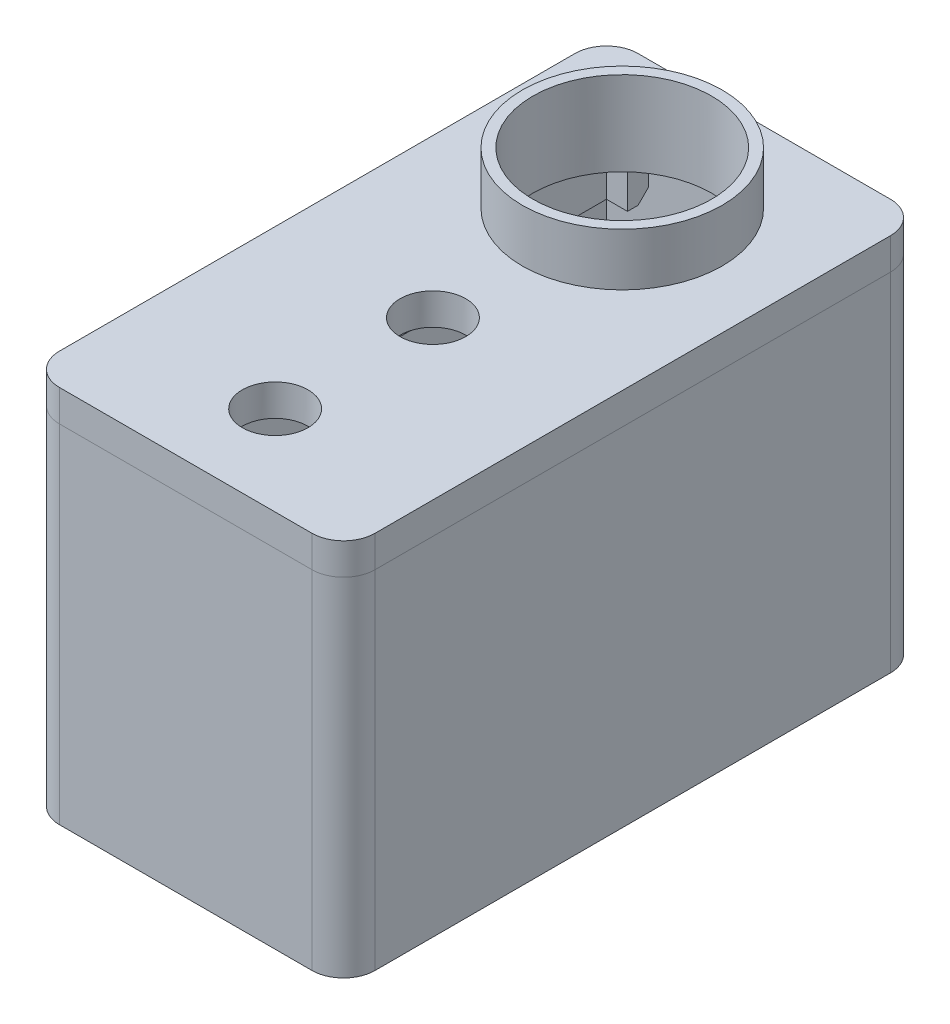
from build123d import *

# Parameters (mm, degrees)
SKETCH1_W                      = 30
SKETCH1_H                      = 55
BOSS_EXTRUDE7_DEPTH            = 3
SKETCH14_W                     = 30
SKETCH14_H                     = 55
SKETCH14_W_2                   = 24
SKETCH14_H_2                   = 49
BOSS_EXTRUDE8_DEPTH            = 33
CUT_EXTRUDE1_DEPTH             = 3
BOSS_EXTRUDE12_DEPTH           = 3
SKETCH31_W                     = 2.2479
SKETCH31_H                     = 3
F_8_CLEARANCE_HOLE3_AT_2_COUNT = 2
F_8_CLEARANCE_HOLE3_AT_2_PITCH = 25
FILLET1_R                      = 3
FILLET2_R                      = 3
FILLET3_R                      = 3
BOSS_EXTRUDE13_DEPTH           = 5
SKETCH36_W                     = 0.75
SKETCH36_H                     = 3.4
CUT_EXTRUDE2_DEPTH             = 6
SKETCH37_R                     = 3.125
SKETCH37_R_2                   = 8.5
CUT_EXTRUDE3_DEPTH             = 3
BOSS_EXTRUDE14_START           = 5
SKETCH38_R                     = 9.5
SKETCH38_R_2                   = 8.5
BOSS_EXTRUDE14_DEPTH           = 5
BOSS_EXTRUDE15_DEPTH           = 5
CHAMFER1_SIZE                  = 1
BOSS_EXTRUDE16_DEPTH           = 3
FILLET4_R                      = 3


with BuildPart() as part:
    # Sketch1 → Boss-Extrude7 (new body)
    with BuildSketch(Plane(origin=(0, 0, 0), x_dir=(1, 0, 0), z_dir=(0, 1, 0))):
        Rectangle(SKETCH1_W, SKETCH1_H)
    extrude(amount=-BOSS_EXTRUDE7_DEPTH)

    # Fillet3
    fillet3_edges = [part.edges().sort_by_distance(p)[0] for p in [
        (15, -1.5, 27.5),
        (-15, -1.5, 27.5),
        (-15, -1.5, -27.5),
        (15, -1.5, -27.5),
    ]]
    fillet(fillet3_edges, radius=FILLET3_R)

    # Sketch35 → Boss-Extrude13 (add, symmetric)
    with BuildSketch(Plane.XY):
        Polygon((10.25, -3), (11.75, -3), (11.75, -8), (12.5, -8), (12.5, -9.5), (11.75, -10.25), (10.25, -10.25), align=None)
        Polygon((-12.5, -9.5), (-11.75, -10.25), (-10.25, -10.25), (-10.25, -3), (-11.75, -3), (-11.75, -8), (-12.5, -8), align=None)
    extrude(amount=BOSS_EXTRUDE13_DEPTH, both=True)

    # Sketch37 → Cut-Extrude3 (cut)
    with BuildSketch(Plane(origin=(0, 0, 0), x_dir=(1, 0, 0), z_dir=(0, 1, 0))):
        with Locations(Location((0, -4, 0), (0, 0, 270))):
            Circle(SKETCH37_R)
        with Locations(Location((0, -19, 0), (0, 0, 270))):
            Circle(SKETCH37_R)
        with Locations(Location((0, 14, 0), (0, 0, 270))):
            Circle(SKETCH37_R_2)
    extrude(amount=-CUT_EXTRUDE3_DEPTH, mode=Mode.SUBTRACT)

    # Sketch38 → Boss-Extrude14 (add)
    with BuildSketch(Plane(origin=(0, 0, 0), x_dir=(1, 0, 0), z_dir=(0, 1, 0)).offset(BOSS_EXTRUDE14_START)):
        with Locations(Location((0, 14, 0), (0, 0, 90))):
            Circle(SKETCH38_R)
        with Locations(Location((0, 14, 0), (0, 0, 180))):
            Circle(SKETCH38_R_2, mode=Mode.SUBTRACT)
    extrude(amount=-BOSS_EXTRUDE14_DEPTH)

    # Sketch39 → Boss-Extrude15 (add)
    with BuildSketch(Plane.XZ.offset(3)):
        Polygon((11.5, 24), (7.5, 24), (7.5, 22), (9.5, 22), (9.5, -22), (7.5, -22), (7.5, -24), (11.5, -24), align=None)
        Polygon((-11.5, 24), (-11.5, -24), (-7.5, -24), (-7.5, -22), (-9.5, -22), (-9.5, 22), (-7.5, 22), (-7.5, 24), align=None)
    extrude(amount=BOSS_EXTRUDE15_DEPTH)

    # Chamfer1
    chamfer1_edges = [part.edges().sort_by_distance(p)[0] for p in [
        (11.5, -8, 14.5),
        (9.5, -8, 24),
        (9.5, -8, -24),
        (11.5, -8, -14.5),
        (-11.5, -8, -14.5),
        (-9.5, -8, -24),
        (-9.5, -8, 24),
        (-11.5, -8, 14.5),
    ]]
    chamfer(chamfer1_edges, length=CHAMFER1_SIZE)


with BuildPart() as body_2:
    # Sketch14 → Boss-Extrude8 (new body)
    with BuildSketch(Plane.XZ.offset(3)):
        Rectangle(SKETCH14_W, SKETCH14_H)
        Rectangle(SKETCH14_W_2, SKETCH14_H_2, mode=Mode.SUBTRACT)
    extrude(amount=BOSS_EXTRUDE8_DEPTH)

    # Sketch17 → Cut-Extrude1 (cut)
    with BuildSketch(Plane(origin=(-12.5, 0, -27.5), x_dir=(-1, 0, 0), z_dir=(0, 0, -1))):
        with BuildLine():
            Line((-17.5, -36), (-17.5, -33))
            ThreePointArc((-17.5, -33), (-12.5, -28), (-7.5, -33))
            Line((-7.5, -33), (-7.5, -36))
            Line((-7.5, -36), (-17.5, -36))
        make_face()
    extrude(amount=-CUT_EXTRUDE1_DEPTH, mode=Mode.SUBTRACT)

    # Sketch29 → Boss-Extrude12 (add)
    with BuildSketch(Plane.XZ.offset(36)):
        with BuildLine():
            Line((-12, 10.5), (-7, 10.5))
            ThreePointArc((-7, 10.5), (-3.464466094, 9.035533906), (-2, 5.5))
            Line((-2, 5.5), (-2, -24.5))
            Line((-2, -24.5), (-12, -24.5))
            Line((-12, -24.5), (-12, 10.5))
        make_face()
    extrude(amount=-BOSS_EXTRUDE12_DEPTH)

    # Sketch31 → #8 Clearance Hole3 (revolve, cut)
    with BuildSketch(Plane(origin=(-7, -33, 5.5), x_dir=(0, 0, 1), z_dir=(1, 0, 0))):
        with Locations((1.12395, 1.5)):
            Rectangle(SKETCH31_W, SKETCH31_H)
    f_8_clearance_hole3 = revolve(axis=Axis((-7, -26.65, 5.5), (0, -1, 0)), mode=Mode.SUBTRACT)

    # #8 Clearance Hole3 at 2: #8 Clearance Hole3 ×2
    with Locations(*[(0, 0, -i * F_8_CLEARANCE_HOLE3_AT_2_PITCH) for i in range(1, F_8_CLEARANCE_HOLE3_AT_2_COUNT)]):
        add(f_8_clearance_hole3, mode=Mode.SUBTRACT)

    # Fillet1
    fillet1_edges = [body_2.edges().sort_by_distance(p)[0] for p in [
        (-2, -34.5, -24.5),
    ]]
    fillet(fillet1_edges, radius=FILLET1_R - 0.0001)  # a hair under: the kernel refuses the full size

    # Fillet2
    fillet2_edges = [body_2.edges().sort_by_distance(p)[0] for p in [
        (-15, -19.5, -27.5),
        (-15, -19.5, 27.5),
        (15, -19.5, 27.5),
        (15, -19.5, -27.5),
    ]]
    fillet(fillet2_edges, radius=FILLET2_R)

    # Sketch36 → Cut-Extrude2 (cut, symmetric)
    with BuildSketch(Plane.XY):
        with Locations((12.125, -9.3)):
            Rectangle(SKETCH36_W, SKETCH36_H)
        with Locations((-12.125, -9.3)):
            Rectangle(SKETCH36_W, SKETCH36_H)
    extrude(amount=CUT_EXTRUDE2_DEPTH, both=True, mode=Mode.SUBTRACT)

    # Sketch41 → Boss-Extrude16 (add)
    with BuildSketch(Plane.XZ.offset(36)):
        with BuildLine():
            Line((-2, -5.5), (-2, 5.5))
            ThreePointArc((-2, 5.5), (-3.464466094, 9.035533906), (-7, 10.5))
            Line((-7, 10.5), (-12, 10.5))
            Line((-12, 10.5), (-12, 24.5))
            Line((-12, 24.5), (12, 24.5))
            Line((12, 24.5), (12, -5.5))
            Line((12, -5.5), (-2, -5.5))
        make_face()
    extrude(amount=-BOSS_EXTRUDE16_DEPTH)

    # Fillet4
    fillet4_edges = [body_2.edges().sort_by_distance(p)[0] for p in [
        (-2, -34.5, -5.5),
        (12, -34.5, -5.5),
    ]]
    fillet(fillet4_edges, radius=FILLET4_R)


solid = Compound([part.part, body_2.part])
